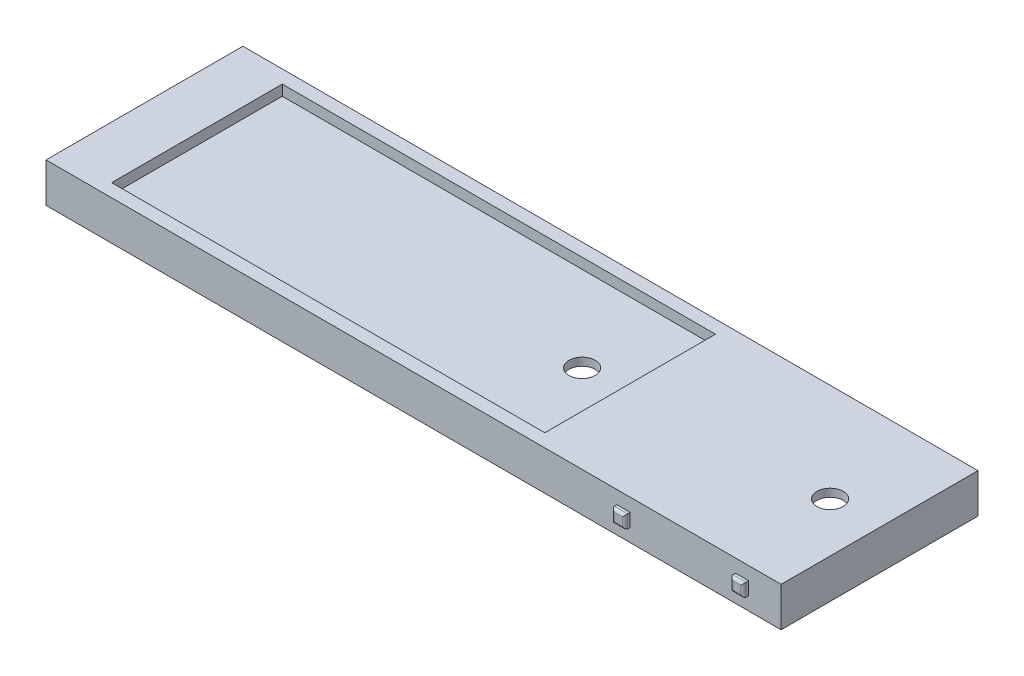
from build123d import *

# Parameters (mm, degrees)
SKETCH1_W            = 280
SKETCH1_H            = 75
BOSS_EXTRUDE1_DEPTH  = 15
SKETCH8_R            = 5
CUT_EXTRUDE4_DEPTH   = 146.709471209
SKETCH10_R           = 5
CUT_EXTRUDE6_DEPTH   = 146.709471209
SKETCH9_W            = 165
SKETCH9_H            = 65
CUT_EXTRUDE5_DEPTH   = 4
SHELL2_OUTLINE_W     = 277
SHELL2_OUTLINE_H     = 69
SHELL2_OUTLINE_R     = 5
SHELL2_DEPTH         = 8
SHELL2_START         = 8
SHELL2_2_OUTLINE_W   = 17
SHELL2_2_OUTLINE_H   = 69
SHELL2_2_OUTLINE_W_2 = 89
SHELL2_2_OUTLINE_R   = 5
SHELL2_2_DEPTH       = 4
SKETCH11_W           = 5
SKETCH11_H           = 5
BOSS_EXTRUDE4_DEPTH  = 2
FILLET1_R            = 1


# Read off the part's stored shape, not the designer's step: Shell2
with BuildPart() as part:
    # Sketch1 → Boss-Extrude1 (new body)
    with BuildSketch(Plane(origin=(0, 0, 0), x_dir=(1, 0, 0), z_dir=(0, 1, 0))):
        Rectangle(SKETCH1_W, SKETCH1_H)
    extrude(amount=BOSS_EXTRUDE1_DEPTH)

    # Sketch8 → Cut-Extrude4 (cut, through all)
    with BuildSketch(Plane(origin=(0, 15, 0), x_dir=(1, 0, 0), z_dir=(0, 1, 0))):
        with Locations(Location((121.166163263, 0, 0), (0, 0, 270))):
            Circle(SKETCH8_R)
    extrude(amount=-CUT_EXTRUDE4_DEPTH, mode=Mode.SUBTRACT)

    # Sketch10 → Cut-Extrude6 (cut, through all)
    with BuildSketch(Plane(origin=(0, 15, 0), x_dir=(1, 0, 0), z_dir=(0, 1, 0))):
        with Locations(Location((26.698268473, 0, 0), (0, 0, 270))):
            Circle(SKETCH10_R)
    extrude(amount=-CUT_EXTRUDE6_DEPTH, mode=Mode.SUBTRACT)

    # Sketch9 → Cut-Extrude5 (cut)
    with BuildSketch(Plane(origin=(0, 15, 0), x_dir=(1, 0, 0), z_dir=(0, 1, 0))):
        with Locations((-37.5, 0)):
            Rectangle(SKETCH9_W, SKETCH9_H)
    extrude(amount=-CUT_EXTRUDE5_DEPTH, mode=Mode.SUBTRACT)

    # Shell2 outline → Shell2 (cut)
    with BuildSketch(Plane(origin=(0, 0, 0), x_dir=(1, 0, 0), z_dir=(0, 1, 0))):
        with Locations((-1.5, 0)):
            Rectangle(SHELL2_OUTLINE_W, SHELL2_OUTLINE_H)
        with Locations((26.698268473, 0)):
            Circle(SHELL2_OUTLINE_R, mode=Mode.SUBTRACT)
        with Locations((121.166163263, 0)):
            Circle(SHELL2_OUTLINE_R, mode=Mode.SUBTRACT)
    extrude(amount=SHELL2_DEPTH, mode=Mode.SUBTRACT)

    # Shell2 2 outline → Shell2 2 (cut)
    # profile 1 of 2: a face of its own
    with BuildSketch(Plane(origin=(0, 0, 0), x_dir=(1, 0, 0), z_dir=(0, 1, 0)).offset(SHELL2_START)):
        with Locations((-131.5, 0)):
            Rectangle(SHELL2_2_OUTLINE_W, SHELL2_2_OUTLINE_H)
    # profile 2 of 2: a face of its own
    with BuildSketch(Plane(origin=(0, 0, 0), x_dir=(1, 0, 0), z_dir=(0, 1, 0)).offset(SHELL2_START)):
        with Locations((92.5, 0)):
            Rectangle(SHELL2_2_OUTLINE_W_2, SHELL2_2_OUTLINE_H)
        with Locations((121.166163263, 0)):
            Circle(SHELL2_2_OUTLINE_R, mode=Mode.SUBTRACT)
    extrude(amount=SHELL2_2_DEPTH, mode=Mode.SUBTRACT)

    # Sketch11 → Boss-Extrude4 (add)
    with BuildSketch(Plane.XY.offset(37.5)):
        with Locations((80, 7.5)):
            Rectangle(SKETCH11_W, SKETCH11_H)
        with Locations((125.124035555, 7.5)):
            Rectangle(SKETCH11_W, SKETCH11_H)
    extrude(amount=BOSS_EXTRUDE4_DEPTH)

    # Fillet1
    fillet1_edges = [part.edges().sort_by_distance(p)[0] for p in [
        (82.5, 7.5, 39.5),
        (80, 10, 39.5),
        (77.5, 7.5, 39.5),
        (80, 5, 39.5),
        (127.624035555, 7.5, 39.5),
        (125.124035555, 10, 39.5),
        (122.624035555, 7.5, 39.5),
        (125.124035555, 5, 39.5),
    ]]
    fillet(fillet1_edges, radius=FILLET1_R)


solid = part.part
